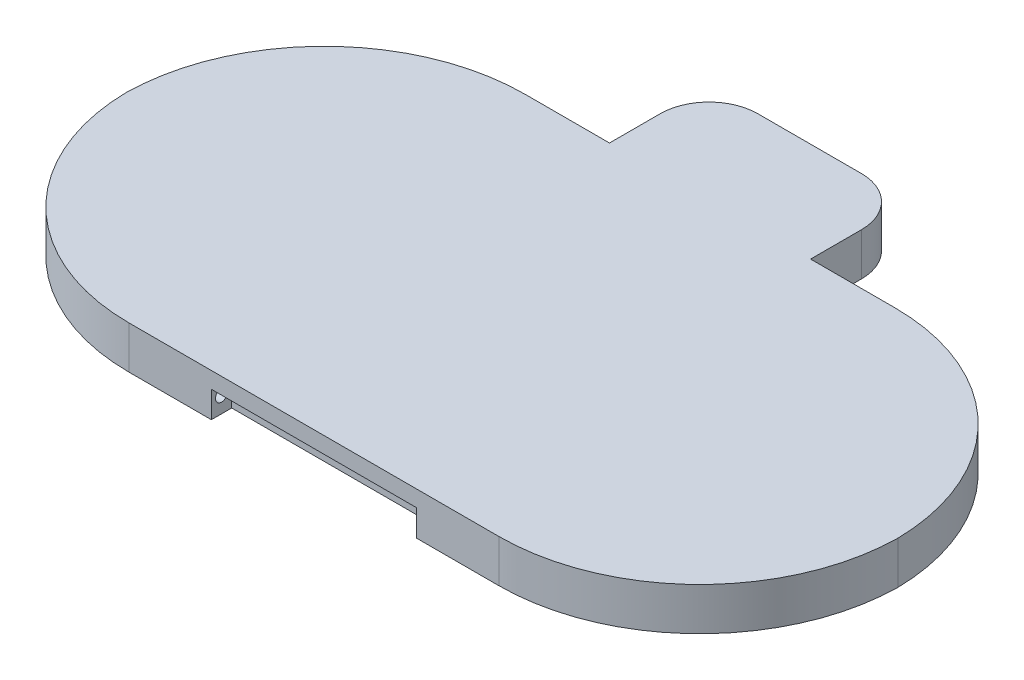
from build123d import *

# Parameters (mm, degrees)
SKETCH1_W               = 380
SKETCH1_H               = 195
BOSS_EXTRUDE1_DEPTH     = 21
FILLET1_R               = 99
SKETCH2_W               = 101
SKETCH2_H               = 20
CUT_EXTRUDE1_DEPTH      = 13
FILLET2_R               = 4
CUT_EXTRUDE2_DEPTH      = 110
CUT_EXTRUDE2_DEPTH_BACK = 10
SKETCH3_R               = 3
SKETCH4_W               = 99
SKETCH4_H               = 21
BOSS_EXTRUDE2_DEPTH     = 49
FILLET3_R               = 24


with BuildPart() as part:
    # Sketch1 → Boss-Extrude1 (new body)
    with BuildSketch(Plane(origin=(0, 0, 0), x_dir=(1, 0, 0), z_dir=(0, 1, 0))):
        Rectangle(SKETCH1_W, SKETCH1_H)
    extrude(amount=BOSS_EXTRUDE1_DEPTH)

    # Fillet1
    # the kernel refuses this fillet: 99 mm, written as the material it takes off along each edge
    with BuildSketch(Plane(origin=(-190, -247.5, 97.5), x_dir=(0, 0, -1), z_dir=(0, 1, 0)), Plane(origin=(-190, -247.5, -97.5), x_dir=(1, 0, 0), z_dir=(0, 1, 0)), Plane(origin=(190, -247.5, 97.5), x_dir=(-1, 0, 0), z_dir=(0, 1, 0))) as fillet1_piece_1:
        with BuildLine():
            CenterArc((FILLET1_R, -FILLET1_R), FILLET1_R, 90, 90)
            Line((0, -FILLET1_R), (0, 0))
            Line((0, 0), (FILLET1_R, 0))
        make_face()
    extrude(amount=516, mode=Mode.SUBTRACT)
    with BuildSketch(Plane(origin=(190, -247.5, -97.5), x_dir=(-1, 0, 0), z_dir=(0, 1, 0))) as fillet1_piece_2:
        with BuildLine():
            CenterArc((FILLET1_R, FILLET1_R), FILLET1_R, 180, 90)
            Line((0, FILLET1_R), (0, 0))
            Line((0, 0), (FILLET1_R, 0))
        make_face()
    extrude(amount=516, mode=Mode.SUBTRACT)

    # Sketch2 → Cut-Extrude1 (cut)
    with BuildSketch(Plane.XZ):
        with Locations((0, 97.5)):
            Rectangle(SKETCH2_W, SKETCH2_H)
    extrude(amount=-CUT_EXTRUDE1_DEPTH, mode=Mode.SUBTRACT)

    # Fillet2
    fillet2_edges = [part.edges().sort_by_distance(p)[0] for p in [
        (0, 13, 87.5),
    ]]
    fillet(fillet2_edges, radius=FILLET2_R)

    # Sketch3 → Cut-Extrude2 (cut, two sides: drawn at the far end of the back side and taken through both)
    with BuildSketch(Plane(origin=(-50.5, 0, 0), x_dir=(0, 0, -1), z_dir=(1, 0, 0)).offset(-CUT_EXTRUDE2_DEPTH_BACK)):
        with Locations((-92.5, 8)):
            Circle(SKETCH3_R)
    extrude(amount=CUT_EXTRUDE2_DEPTH + CUT_EXTRUDE2_DEPTH_BACK, mode=Mode.SUBTRACT)

    # Sketch4 → Boss-Extrude2 (add)
    with BuildSketch(Plane(origin=(0, 0, -97.5), x_dir=(-1, 0, 0), z_dir=(0, 0, -1))):
        with Locations((0, 10.5)):
            Rectangle(SKETCH4_W, SKETCH4_H)
    extrude(amount=BOSS_EXTRUDE2_DEPTH)

    # Fillet3
    fillet3_edges = [part.edges().sort_by_distance(p)[0] for p in [
        (49.5, 10.5, -146.5),
        (-49.5, 10.5, -146.5),
    ]]
    fillet(fillet3_edges, radius=FILLET3_R)


solid = part.part
